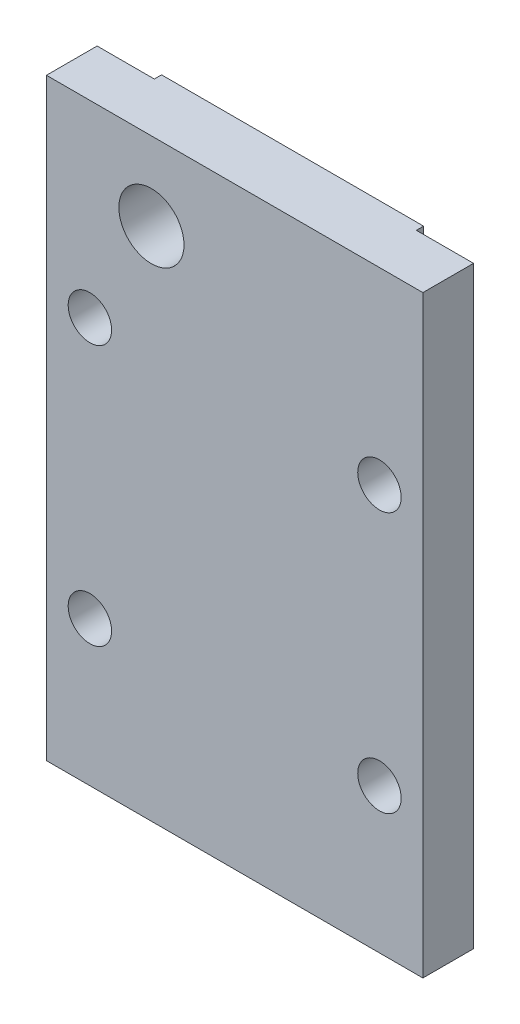
from build123d import *

# Parameters (mm, degrees)
SKETCH1_W           = 26
SKETCH1_H           = 41
SKETCH1_R           = 2.25
SKETCH1_R_2         = 1.5
BOSS_EXTRUDE1_DEPTH = 4
SKETCH3_OUTSIDE_W   = 37.742
SKETCH3_OUTSIDE_H   = 52.742
CUT_EXTRUDE1_DEPTH  = 0.5


with BuildPart() as part:
    # Sketch1 → Boss-Extrude1 (new body)
    with BuildSketch(Plane.XY):
        with Locations((13, 20.5)):
            Rectangle(SKETCH1_W, SKETCH1_H)
        with Locations((7.25, 35.6)):
            Circle(SKETCH1_R, mode=Mode.SUBTRACT)
        with Locations((3, 28)):
            Circle(SKETCH1_R_2, mode=Mode.SUBTRACT)
        with Locations((3, 10)):
            Circle(SKETCH1_R_2, mode=Mode.SUBTRACT)
        with Locations((23, 10)):
            Circle(SKETCH1_R_2, mode=Mode.SUBTRACT)
        with Locations((23, 28)):
            Circle(SKETCH1_R_2, mode=Mode.SUBTRACT)
    extrude(amount=BOSS_EXTRUDE1_DEPTH)

    # Sketch3 outside → Cut-Extrude1 (cut)
    with BuildSketch(Plane(origin=(0, 0, 0), x_dir=(-1, 0, 0), z_dir=(0, 0, -1))):
        with Locations((-13, 20.5)):
            Rectangle(SKETCH3_OUTSIDE_W, SKETCH3_OUTSIDE_H)
        with BuildLine():
            Line((-3.95, 41), (-22.05, 41))
            Line((-22.05, 41), (-22.05, 31))
            Line((-22.05, 31), (-15.7, 31))
            ThreePointArc((-15.7, 31), (-14.2, 29.5), (-15.7, 28))
            Line((-15.7, 28), (-15.7, 12))
            ThreePointArc((-15.7, 12), (-14.2, 10.5), (-15.7, 9))
            Line((-15.7, 9), (-17.45, 9))
            Line((-17.45, 9), (-17.45, 4))
            Line((-17.45, 4), (-8.55, 4))
            Line((-8.55, 4), (-8.55, 9))
            Line((-8.55, 9), (-10.3, 9))
            ThreePointArc((-10.3, 9), (-11.8, 10.5), (-10.3, 12))
            Line((-10.3, 12), (-10.3, 28))
            ThreePointArc((-10.3, 28), (-11.8, 29.5), (-10.3, 31))
            Line((-10.3, 31), (-3.95, 31))
            Line((-3.95, 31), (-3.95, 41))
        make_face(mode=Mode.SUBTRACT)
    extrude(amount=-CUT_EXTRUDE1_DEPTH, mode=Mode.SUBTRACT)


solid = part.part
